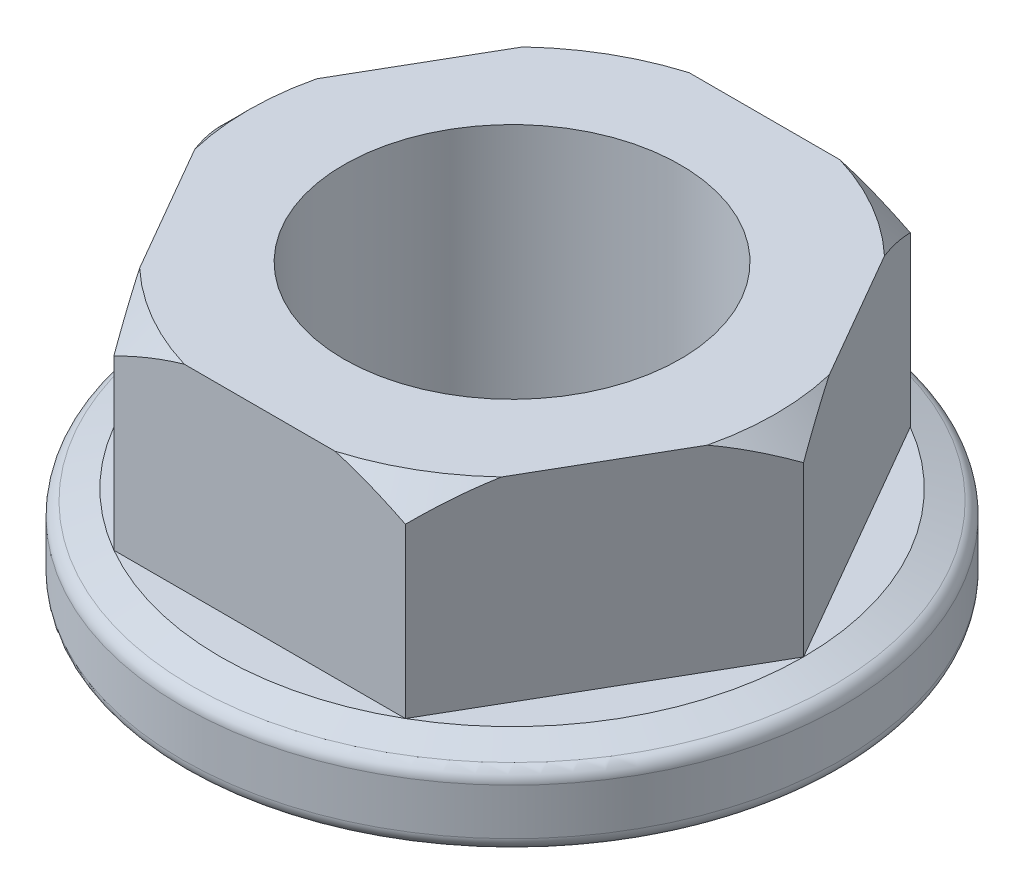
from build123d import *

# Parameters (mm, degrees)
SKETCH1_R           = 6
BOSS_EXTRUDE1_DEPTH = 10
SKETCH2_R           = 11.75
BOSS_EXTRUDE2_DEPTH = 3
FILLET1_R           = 0.5


with BuildPart() as part:
    # Sketch1 → Boss-Extrude1 (new body)
    with BuildSketch(Plane(origin=(0, 0, 0), x_dir=(1, 0, 0), z_dir=(0, 1, 0))):
        Polygon((10.392304845, 0), (5.196152423, 9), (-5.196152423, 9), (-10.392304845, 0), (-5.196152423, -9), (5.196152423, -9), align=None)
        Circle(SKETCH1_R, mode=Mode.SUBTRACT)
    extrude(amount=BOSS_EXTRUDE1_DEPTH)

    # Sketch2 → Boss-Extrude2 (add)
    with BuildSketch(Plane.XZ):
        Circle(SKETCH2_R)
        Polygon((10.392304845, 0), (5.196152423, 9), (-5.196152423, 9), (-10.392304845, 0), (-5.196152423, -9), (5.196152423, -9), align=None, mode=Mode.SUBTRACT)
    extrude(amount=-BOSS_EXTRUDE2_DEPTH)

    # Sketch3 → Cut-Revolve1 (revolve, cut)
    with BuildSketch(Plane.XY):
        Polygon((-10.392304845, 9), (-9.392304845, 10), (-10.392304845, 10), align=None)
        Polygon((-10.392304845, 3), (-11.75, 2.5), (-11.75, 3), align=None)
    revolve(axis=Axis((0, 0, 0), (0, 1, 0)), mode=Mode.SUBTRACT)

    # Fillet1
    fillet1_edges = [part.edges().sort_by_distance(p)[0] for p in [
        (-11.75, 0, 0),
        (0, 2.5, -11.75),
    ]]
    fillet(fillet1_edges, radius=FILLET1_R)


solid = part.part
